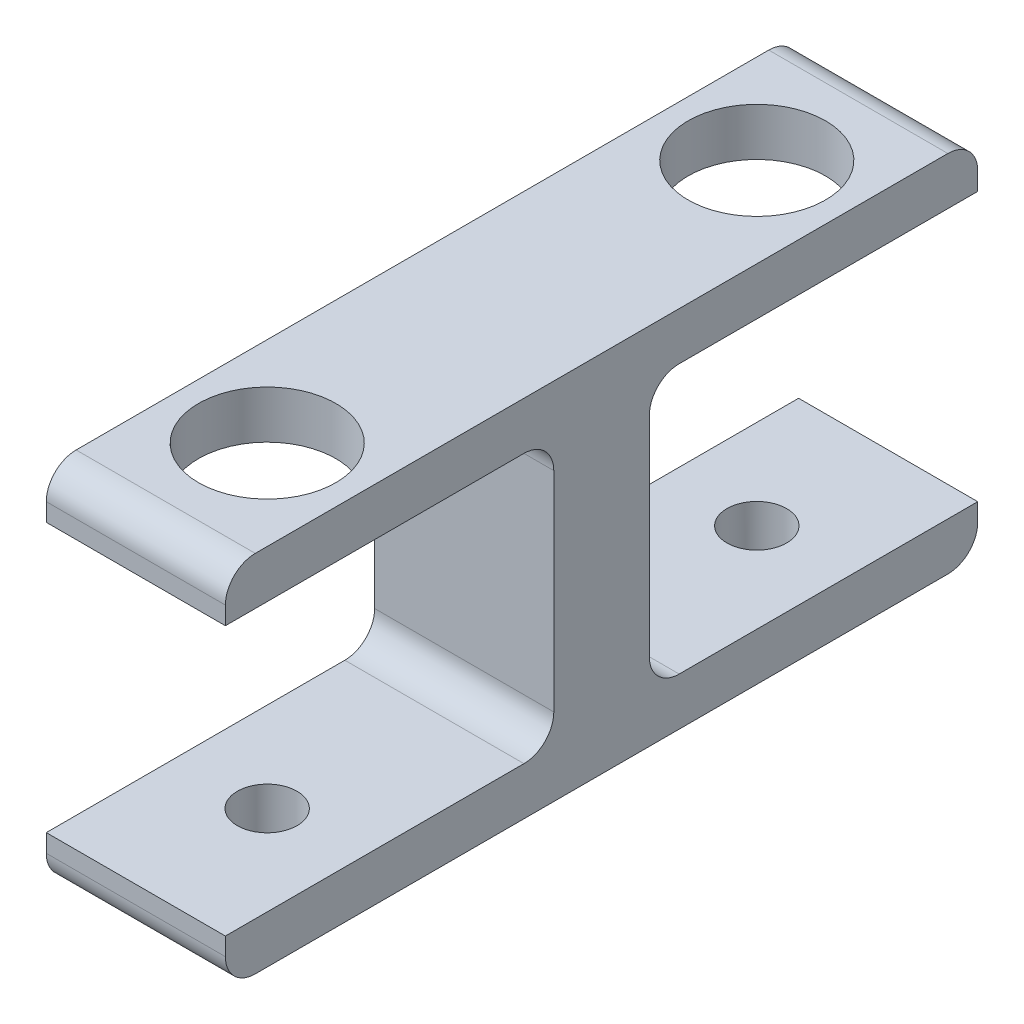
from build123d import *

# Parameters (mm, degrees)
BOSS_EXTRUDE1_DEPTH  = 30
CUT_EXTRUDE1_REACH   = 94.682
SKETCH2_R            = 11.5
CUT_EXTRUDE2_REACH   = 89.624
SKETCH3_R            = 5
FILLET2_R            = 5
FILLET2_OF_MIRROR2_R = 5
FILLET3_R            = 5


with BuildPart() as part:
    # Sketch1 → Boss-Extrude1 (new body)
    with BuildSketch(Plane(origin=(0, 0, 0), x_dir=(0, 0, -1), z_dir=(1, 0, 0))):
        Polygon((0, 0), (55, 0), (55, -45), (0, -45), (0, -53), (63, -53), (63, 8), (0, 8), align=None)
    boss_extrude1 = extrude(amount=BOSS_EXTRUDE1_DEPTH)

    # Sketch2 → Cut-Extrude1 (cut, up to next)
    with BuildSketch(Plane(origin=(0, 8, 0), x_dir=(1, 0, 0), z_dir=(0, 1, 0)), mode=Mode.PRIVATE) as cut_extrude1_sk1:
        with Locations((15, 22)):
            Circle(SKETCH2_R)
    cut_extrude1_tool1 = extrude(cut_extrude1_sk1.sketch, amount=-CUT_EXTRUDE1_REACH, mode=Mode.PRIVATE) & part.part
    cut_extrude1 = cut_extrude1_tool1.solids().sort_by_distance((15, 8, -22))[0]
    add(cut_extrude1, mode=Mode.SUBTRACT)

    # Sketch3 → Cut-Extrude2 (cut, up to next)
    with BuildSketch(Plane(origin=(0, -45, 0), x_dir=(1, 0, 0), z_dir=(0, 1, 0)), mode=Mode.PRIVATE) as cut_extrude2_sk1:
        with Locations((15, 22)):
            Circle(SKETCH3_R)
    cut_extrude2_tool1 = extrude(cut_extrude2_sk1.sketch, amount=-CUT_EXTRUDE2_REACH, mode=Mode.PRIVATE) & part.part
    cut_extrude2 = cut_extrude2_tool1.solids().sort_by_distance((15, -45, -22))[0]
    add(cut_extrude2, mode=Mode.SUBTRACT)

    # Fillet2
    fillet2_edges = [part.edges().sort_by_distance(p)[0] for p in [
        (15, 0, -55),
        (15, -45, -55),
    ]]
    fillet(fillet2_edges, radius=FILLET2_R)

    # Mirror2: Boss-Extrude1, Cut-Extrude1, Cut-Extrude2 across plane
    add(boss_extrude1.mirror(Plane(origin=(30, -53, -63), x_dir=(1, 0, 0), z_dir=(0, 0, 1))))
    add(cut_extrude1.mirror(Plane(origin=(30, -53, -63), x_dir=(1, 0, 0), z_dir=(0, 0, 1))), mode=Mode.SUBTRACT)
    add(cut_extrude2.mirror(Plane(origin=(30, -53, -63), x_dir=(1, 0, 0), z_dir=(0, 0, 1))), mode=Mode.SUBTRACT)

    # Fillet2 of Mirror2
    fillet2_of_mirror2_edges = [part.edges().sort_by_distance(p)[0] for p in [
        (15, 0, -71),
        (15, -45, -71),
    ]]
    fillet(fillet2_of_mirror2_edges, radius=FILLET2_OF_MIRROR2_R)

    # Fillet3
    fillet3_edges = [part.edges().sort_by_distance(p)[0] for p in [
        (15, -53, -126),
        (15, 8, -126),
        (15, -53, 0),
        (15, 8, 0),
    ]]
    fillet(fillet3_edges, radius=FILLET3_R)


solid = part.part
